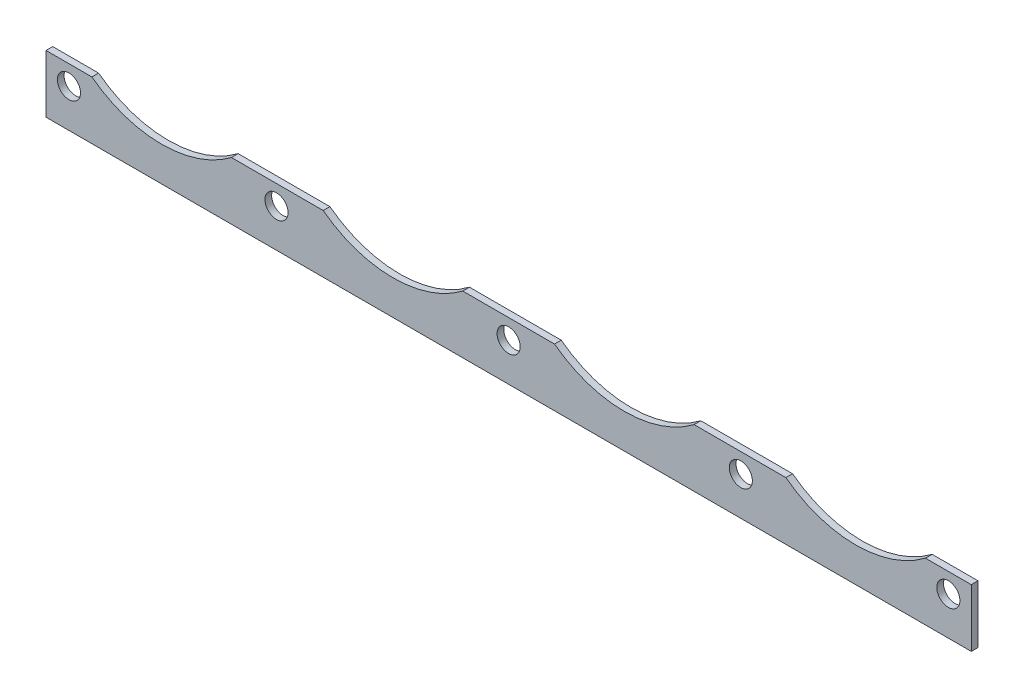
from build123d import *

# Parameters (mm, degrees)
SKETCH1_R           = 2.54
BOSS_EXTRUDE1_DEPTH = 0.7366


with BuildPart() as part:
    # Sketch1 → Boss-Extrude1 (new, symmetric)
    with BuildSketch(Plane.XY):
        with BuildLine():
            Line((10.073619274, 12.7), (-10.073619274, 12.7))
            ThreePointArc((-10.073619274, 12.7), (-25.4, 7.554926656), (-40.726380726, 12.7))
            Line((-40.726380726, 12.7), (-60.873619274, 12.7))
            ThreePointArc((-60.873619274, 12.7), (-76.2, 7.554926656), (-91.526380726, 12.7))
            Line((-91.526380726, 12.7), (-101.6, 12.7))
            Line((-101.6, 12.7), (-101.6, 0))
            Line((-101.6, 0), (101.6, 0))
            Line((101.6, 0), (101.6, 12.7))
            Line((101.6, 12.7), (91.526380726, 12.7))
            ThreePointArc((91.526380726, 12.7), (76.2, 7.554926656), (60.873619274, 12.7))
            Line((60.873619274, 12.7), (40.726380726, 12.7))
            ThreePointArc((40.726380726, 12.7), (25.4, 7.554926656), (10.073619274, 12.7))
        make_face()
        with Locations((0, 8.398896076)):
            Circle(SKETCH1_R, mode=Mode.SUBTRACT)
        with Locations((50.984733006, 8.398896076)):
            Circle(SKETCH1_R, mode=Mode.SUBTRACT)
        with Locations((96.562042846, 8.398896076)):
            Circle(SKETCH1_R, mode=Mode.SUBTRACT)
        with Locations((-96.562042846, 8.398896076)):
            Circle(SKETCH1_R, mode=Mode.SUBTRACT)
        with Locations((-50.984733006, 8.398896076)):
            Circle(SKETCH1_R, mode=Mode.SUBTRACT)
    extrude(amount=BOSS_EXTRUDE1_DEPTH, both=True)


solid = part.part
